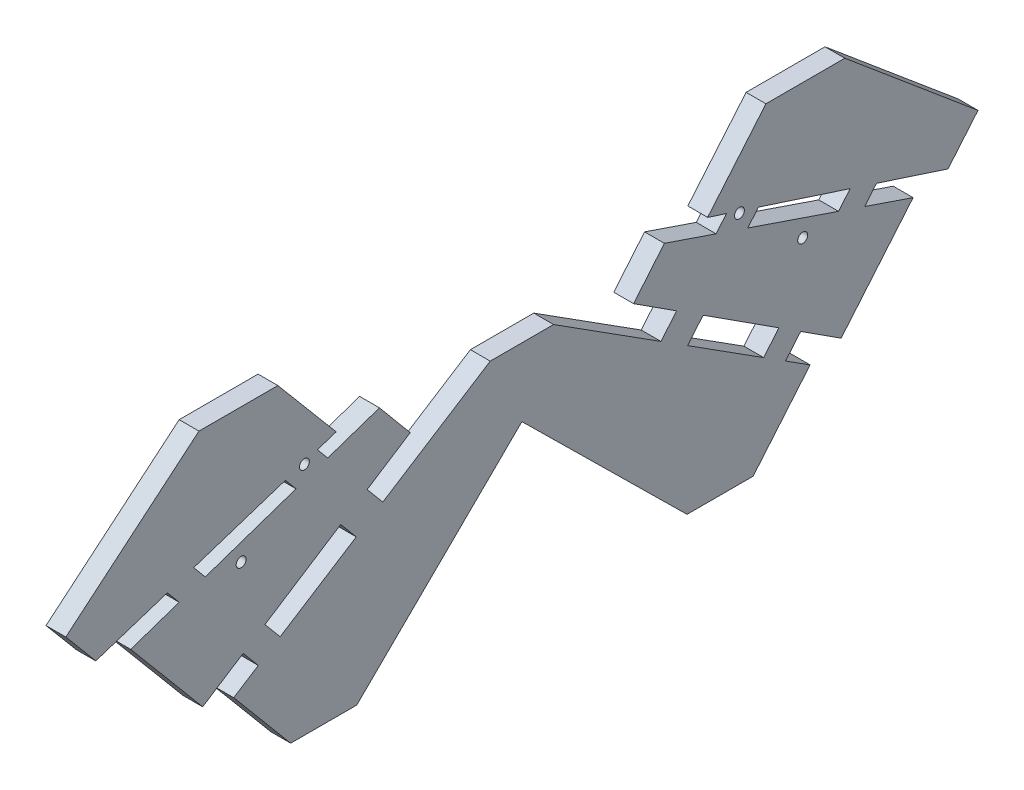
from build123d import *

# Parameters (mm, degrees)
SKETCH1_R           = 1.5
BOSS_EXTRUDE1_DEPTH = 6


with BuildPart() as part:
    # Sketch1 → Boss-Extrude1 (new body)
    with BuildSketch(Plane(origin=(0, 0, 0), x_dir=(0, 0, -1), z_dir=(1, 0, 0))):
        Polygon((50, 0), (70, 0), (87.254152026, 20.562697664), (79.80823441, 25.300304776), (84.391795507, 30.762780181), (96.649533547, 22.868861321), (118.430995622, 48.826997), (103.750045686, 53.833044377), (107.346185212, 58.118756577), (129.00358443, 51.073598636), (138.075544473, 61.885139609), (97.759709388, 95.71414196), (73.871862756, 95.71414196), (56.224558818, 74.748635747), (61.913904513, 72.897890023), (58.782806964, 69.166393271), (43.131591149, 74.503290966), (33.810152707, 63.337092238), (46.846770489, 54.94157892), (42.104534985, 49.290002722), (9.59050621, 69.977673726), (0, 69.977673726), (0, 49.308119656), align=None)
        with Locations((85, 55)):
            Circle(SKETCH1_R, mode=Mode.SUBTRACT)
        with Locations((65.848888922, 71.069690242)):
            Circle(SKETCH1_R, mode=Mode.SUBTRACT)
        Polygon((99.371142131, 60.713040291), (95.856634647, 56.52461337), (68.376268168, 65.895125301), (71.606579328, 69.744860231), align=None, mode=Mode.SUBTRACT)
        Polygon((77.801257076, 35.007052284), (73.18984276, 29.511382707), (50.148368406, 44.171960274), (54.85675178, 49.783193076), align=None, mode=Mode.SUBTRACT)
    boss_extrude1 = extrude(amount=BOSS_EXTRUDE1_DEPTH)

    # Sketch2 → Tap Drill for M3 Tap1 (revolve, cut)
    with BuildSketch(Plane(origin=(3, 0, -60), x_dir=(0, 0, -1), z_dir=(1, 0, 0))):
        Polygon((0, 0), (0, 10.751075774), (1.25, 10), (1.25, 0), align=None)
    tap_drill_for_m3_tap1 = revolve(axis=Axis((3, -6.35, -60), (0, 1, 0)), mode=Mode.SUBTRACT)

    # Mirror1: Boss-Extrude1, Tap Drill for M3 Tap1 across plane
    add(boss_extrude1.mirror(Plane.XY))
    add(tap_drill_for_m3_tap1.mirror(Plane.XY), mode=Mode.SUBTRACT)


solid = part.part
